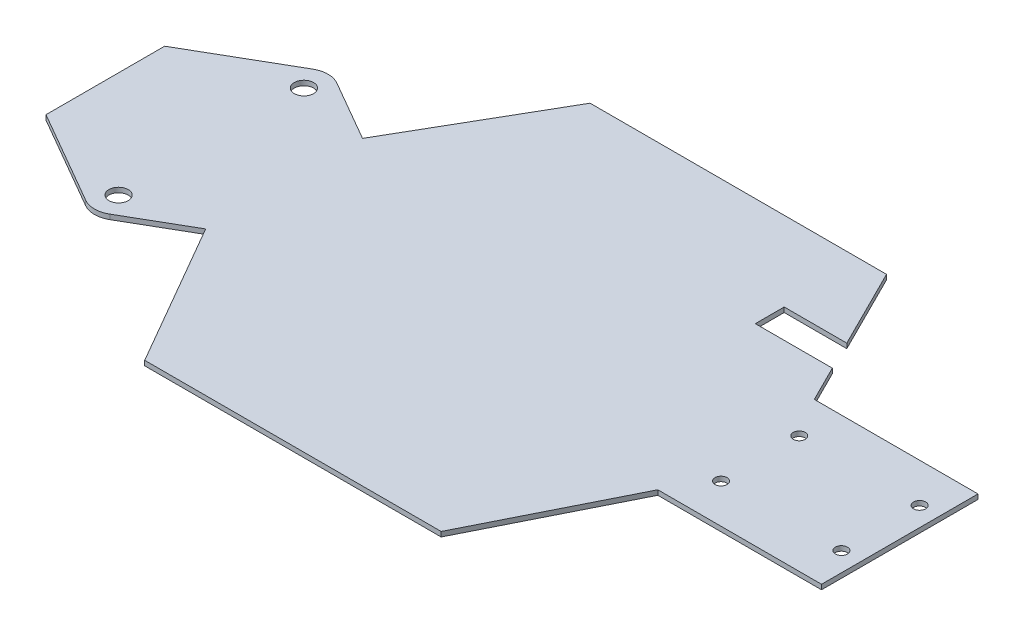
from build123d import *

# Parameters (mm, degrees)
SKETCH1_R           = 4
SKETCH1_R_2         = 2.5
BOSS_EXTRUDE1_DEPTH = 2


with BuildPart() as part:
    # Sketch1 → Boss-Extrude1 (new body)
    with BuildSketch(Plane(origin=(0, 0, 0), x_dir=(1, 0, 0), z_dir=(0, 1, 0))):
        with BuildLine():
            Line((165, -32.5), (165, 32.5))
            Line((165, 32.5), (97, 32.5))
            Line((97, 32.5), (89.5, 47.5))
            Line((89.5, 47.5), (57.5, 47.5))
            Line((57.5, 47.5), (57.5, 59.5))
            Line((57.5, 59.5), (83.5, 59.5))
            Line((83.5, 59.5), (67, 92.5))
            Line((67, 92.5), (-56.134697257, 92.5))
            Line((-56.134697257, 92.5), (-90.733708845, 32.572754038))
            Line((-90.733708845, 32.572754038), (-116, 47.160254038))
            ThreePointArc((-116, 47.160254038), (-121, 48.5), (-126, 47.160254038))
            Line((-126, 47.160254038), (-165, 24.643593539))
            Line((-165, 24.643593539), (-165, -24.643593539))
            Line((-165, -24.643593539), (-126, -47.160254038))
            ThreePointArc((-126, -47.160254038), (-121, -48.5), (-116, -47.160254038))
            Line((-116, -47.160254038), (-90.733708845, -32.572754038))
            Line((-90.733708845, -32.572754038), (-56.134697257, -92.5))
            Line((-56.134697257, -92.5), (67, -92.5))
            Line((67, -92.5), (97, -32.5))
            Line((97, -32.5), (165, -32.5))
        make_face()
        with Locations((-121, -38.5)):
            Circle(SKETCH1_R, mode=Mode.SUBTRACT)
        with Locations((107, -16.25)):
            Circle(SKETCH1_R_2, mode=Mode.SUBTRACT)
        with Locations((157, -16.25)):
            Circle(SKETCH1_R_2, mode=Mode.SUBTRACT)
        with Locations((-121, 38.5)):
            Circle(SKETCH1_R, mode=Mode.SUBTRACT)
        with Locations((107, 16.25)):
            Circle(SKETCH1_R_2, mode=Mode.SUBTRACT)
        with Locations((157, 16.25)):
            Circle(SKETCH1_R_2, mode=Mode.SUBTRACT)
    extrude(amount=BOSS_EXTRUDE1_DEPTH)


solid = part.part
